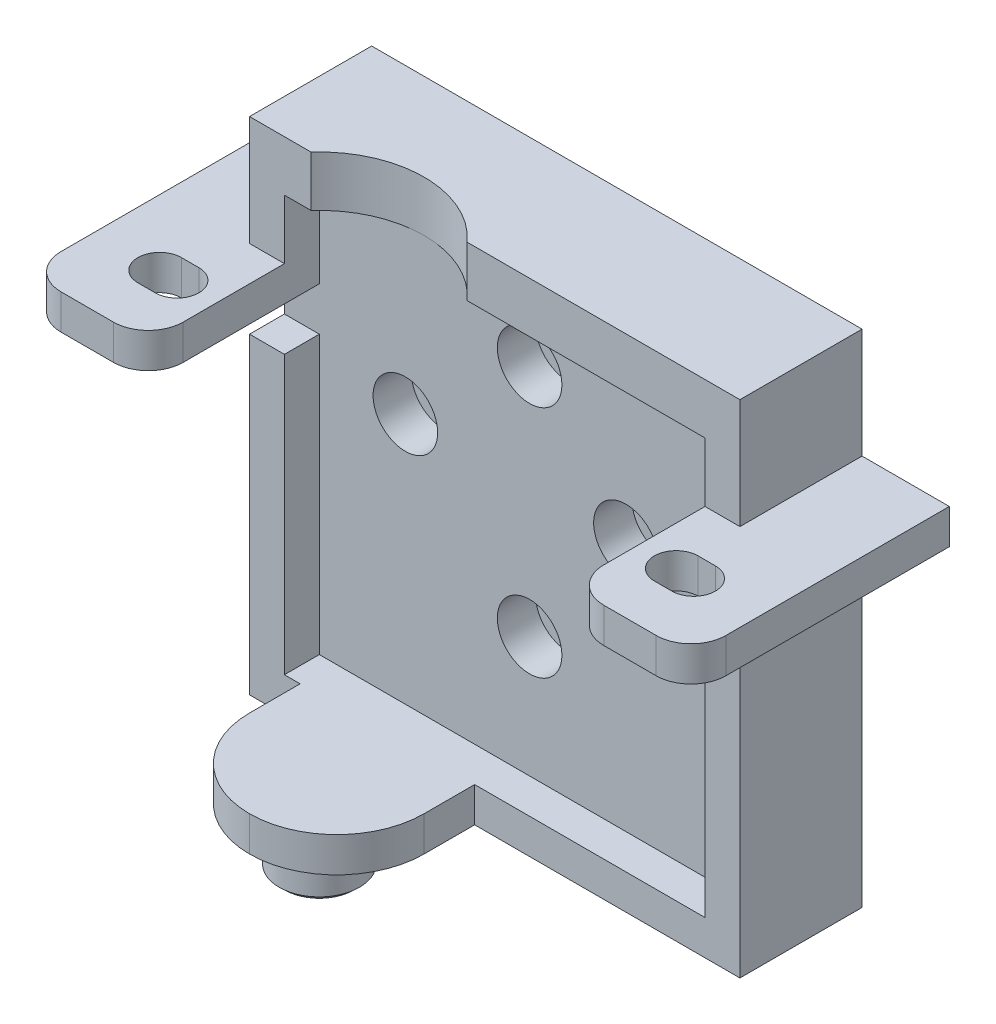
from build123d import *

# Parameters (mm, degrees)
SKETCH4_W                        = 24.1
SKETCH4_H                        = 23.8
BOSS_EXTRUDE2_DEPTH              = 2
SKETCH1_W                        = 28.1
SKETCH1_H                        = 28.7
SKETCH1_W_2                      = 24.1
SKETCH1_H_2                      = 23.8
BOSS_EXTRUDE3_DEPTH              = 4
SKETCH6_W                        = 2
SKETCH6_H                        = 2.5
CUT_EXTRUDE2_DEPTH               = 2
SKETCH8_W                        = 7
SKETCH8_H                        = 2
BOSS_EXTRUDE4_DEPTH              = 11.8
SKETCH11_R                       = 6
CUT_EXTRUDE4_DEPTH               = 4
SKETCH12_W                       = 10
SKETCH12_H                       = 2
BOSS_EXTRUDE5_DEPTH              = 7.9
FILLET9_R                        = 5
FILLET10_R                       = 5
SKETCH14_R                       = 2.3
BOSS_EXTRUDE6_DEPTH              = 2.5
DOME3_FACE_RADIUS                = 2.3
DOME3_HEIGHT                     = 1
FILLET11_R                       = 2
FILLET12_R                       = 2
FILLET13_R                       = 2
FILLET14_R                       = 2
BOSS_EXTRUDE7_DEPTH              = 3
SKETCH19_R                       = 0.3
CUT_EXTRUDE6_DEPTH               = 2
CBORE_START                      = -0.2
CBORE_FOR_M1_6_SHCS1_OUTLINE_R   = 1.85
CBORE_FOR_M1_6_SHCS1_DEPTH       = 2.2
CBORE_START_2                    = -3
CBORE_FOR_M1_6_SHCS1_2_OUTLINE_R = 1
CBORE_FOR_M1_6_SHCS1_2_DEPTH     = 2.8
CUT_EXTRUDE8_DEPTH               = 2


# Read off the part's stored shape, not the designer's step: CBORE for M1.6 SHCS1
with BuildPart() as part:
    # Sketch4 → Boss-Extrude2 (new body)
    with BuildSketch(Plane.XY):
        with Locations((14.05, 13.9)):
            Rectangle(SKETCH4_W, SKETCH4_H)
    extrude(amount=BOSS_EXTRUDE2_DEPTH)

    # Sketch1 → Boss-Extrude3 (add)
    with BuildSketch(Plane.XY):
        with Locations((14.05, 14.35)):
            Rectangle(SKETCH1_W, SKETCH1_H)
        with Locations((14.05, 13.9)):
            Rectangle(SKETCH1_W_2, SKETCH1_H_2, mode=Mode.SUBTRACT)
    extrude(amount=BOSS_EXTRUDE3_DEPTH)

    # Sketch6 → Cut-Extrude2 (cut)
    with BuildSketch(Plane.XY.offset(4)):
        with Locations((1, 19.15)):
            Rectangle(SKETCH6_W, SKETCH6_H)
        with Locations((27.1, 19.15)):
            Rectangle(SKETCH6_W, SKETCH6_H)
    extrude(amount=-CUT_EXTRUDE2_DEPTH, mode=Mode.SUBTRACT)

    # Sketch8 → Boss-Extrude4 (add)
    with BuildSketch(Plane.XY):
        with Locations((-1.5, 21.4)):
            Rectangle(SKETCH8_W, SKETCH8_H)
        with Locations((29.6, 21.4)):
            Rectangle(SKETCH8_W, SKETCH8_H)
    extrude(amount=BOSS_EXTRUDE4_DEPTH)

    # Sketch11 → Cut-Extrude4 (cut)
    with BuildSketch(Plane(origin=(0, 25.8, 0), x_dir=(-1, 0, 0), z_dir=(0, -1, 0))):
        with Locations((-8, -8)):
            Circle(SKETCH11_R)
    extrude(amount=-CUT_EXTRUDE4_DEPTH, mode=Mode.SUBTRACT)

    # Sketch12 → Boss-Extrude5 (add)
    with BuildSketch(Plane.XY.offset(4)):
        with Locations((7.9, 1)):
            Rectangle(SKETCH12_W, SKETCH12_H)
    extrude(amount=BOSS_EXTRUDE5_DEPTH)

    # Fillet9
    fillet9_edges = [part.edges().sort_by_distance(p)[0] for p in [
        (2.9, 1, 11.9),
    ]]
    fillet(fillet9_edges, radius=FILLET9_R)

    # Fillet10
    fillet10_edges = [part.edges().sort_by_distance(p)[0] for p in [
        (12.9, 1, 11.9),
    ]]
    fillet(fillet10_edges, radius=FILLET10_R - 0.0001)  # a hair under: the kernel refuses the full size

    # Sketch14 → Boss-Extrude6 (add)
    with BuildSketch(Plane(origin=(0, 0, 0), x_dir=(-1, 0, 0), z_dir=(0, -1, 0))):
        with Locations(Location((-7.9, -7.9, 0), (0, 0, 270))):
            Circle(SKETCH14_R)
    extrude(amount=BOSS_EXTRUDE6_DEPTH)

    # Dome3: a dome of height H over a round flat face of radius A is a cap of a sphere of radius (A * A + H * H) / (2 * H)
    dome3_r = (DOME3_FACE_RADIUS * DOME3_FACE_RADIUS + DOME3_HEIGHT * DOME3_HEIGHT) / (2 * DOME3_HEIGHT)
    dome3_base = Plane((7.9, -2.5, 7.9), z_dir=(0, -1, 0))
    with Locations(dome3_base.offset(DOME3_HEIGHT - dome3_r)):
        dome3_ball = Sphere(dome3_r, mode=Mode.PRIVATE)
    add(split(dome3_ball, bisect_by=dome3_base, keep=Keep.TOP, mode=Mode.PRIVATE))

    # Fillet11
    fillet11_edges = [part.edges().sort_by_distance(p)[0] for p in [
        (2, 21.4, 11.8),
    ]]
    fillet(fillet11_edges, radius=FILLET11_R)

    # Fillet12
    fillet12_edges = [part.edges().sort_by_distance(p)[0] for p in [
        (-5, 21.4, 11.8),
    ]]
    fillet(fillet12_edges, radius=FILLET12_R)

    # Fillet13
    fillet13_edges = [part.edges().sort_by_distance(p)[0] for p in [
        (33.1, 21.4, 11.8),
    ]]
    fillet(fillet13_edges, radius=FILLET13_R)

    # Fillet14
    fillet14_edges = [part.edges().sort_by_distance(p)[0] for p in [
        (26.1, 21.4, 11.8),
    ]]
    fillet(fillet14_edges, radius=FILLET14_R)

    # Sketch16 → Boss-Extrude7 (add)
    with BuildSketch(Plane.XY):
        Polygon((33.1, 22.4), (28.1, 22.4), (28.1, 28.7), (0, 28.7), (0, 22.4), (-5, 22.4), (-5, 20.4), (0, 20.4), (0, 0), (28.1, 0), (28.1, 20.4), (33.1, 20.4), align=None)
    extrude(amount=-BOSS_EXTRUDE7_DEPTH)

    # Sketch19 → Cut-Extrude6 (cut)
    with BuildSketch(Plane.XY):
        with Locations((19.57, 15.62440581)):
            Circle(SKETCH19_R)
        with Locations((13.25, 22.33440581)):
            Circle(SKETCH19_R)
        with Locations(Location((6.93, 15.62440581, 0), (0, 0, 180))):
            Circle(SKETCH19_R)
        with Locations(Location((13.25, 8.91440581, 0), (0, 0, 180))):
            Circle(SKETCH19_R)
    extrude(amount=CUT_EXTRUDE6_DEPTH, mode=Mode.SUBTRACT)

    # CBORE for M1.6 SHCS1 outline → CBORE for M1.6 SHCS1 (cut)
    with BuildSketch(Plane.XY.offset(CBORE_START)):
        with Locations((14.05, 8.91440581)):
            Circle(CBORE_FOR_M1_6_SHCS1_OUTLINE_R)
        with Locations((19.57, 16.4)):
            Circle(CBORE_FOR_M1_6_SHCS1_OUTLINE_R)
        with Locations((14.05, 22.33440581)):
            Circle(CBORE_FOR_M1_6_SHCS1_OUTLINE_R)
        with Locations((6.93, 16.4)):
            Circle(CBORE_FOR_M1_6_SHCS1_OUTLINE_R)
    extrude(amount=CBORE_FOR_M1_6_SHCS1_DEPTH, mode=Mode.SUBTRACT)

    # CBORE for M1.6 SHCS1 2 outline → CBORE for M1.6 SHCS1 2 (cut)
    with BuildSketch(Plane.XY.offset(CBORE_START_2)):
        with Locations((14.05, 8.91440581)):
            Circle(CBORE_FOR_M1_6_SHCS1_2_OUTLINE_R)
        with Locations((19.57, 16.4)):
            Circle(CBORE_FOR_M1_6_SHCS1_2_OUTLINE_R)
        with Locations((14.05, 22.33440581)):
            Circle(CBORE_FOR_M1_6_SHCS1_2_OUTLINE_R)
        with Locations((6.93, 16.4)):
            Circle(CBORE_FOR_M1_6_SHCS1_2_OUTLINE_R)
    extrude(amount=CBORE_FOR_M1_6_SHCS1_2_DEPTH, mode=Mode.SUBTRACT)

    # Sketch10 → Cut-Extrude8 (cut)
    with BuildSketch(Plane(origin=(0, 20.4, 0), x_dir=(-1, 0, 0), z_dir=(0, -1, 0))):
        with BuildLine():
            Line((-29.35, -6.65), (-28.35, -6.65))
            ThreePointArc((-28.35, -6.65), (-27.1, -7.9), (-28.35, -9.15))
            Line((-28.35, -9.15), (-29.35, -9.15))
            ThreePointArc((-29.35, -9.15), (-30.6, -7.9), (-29.35, -6.65))
        make_face()
        with BuildLine():
            Line((1.25, -6.65), (0.25, -6.65))
            ThreePointArc((0.25, -6.65), (-1, -7.9), (0.25, -9.15))
            Line((0.25, -9.15), (1.25, -9.15))
            ThreePointArc((1.25, -9.15), (2.5, -7.9), (1.25, -6.65))
        make_face()
    extrude(amount=-CUT_EXTRUDE8_DEPTH, mode=Mode.SUBTRACT)


solid = part.part
